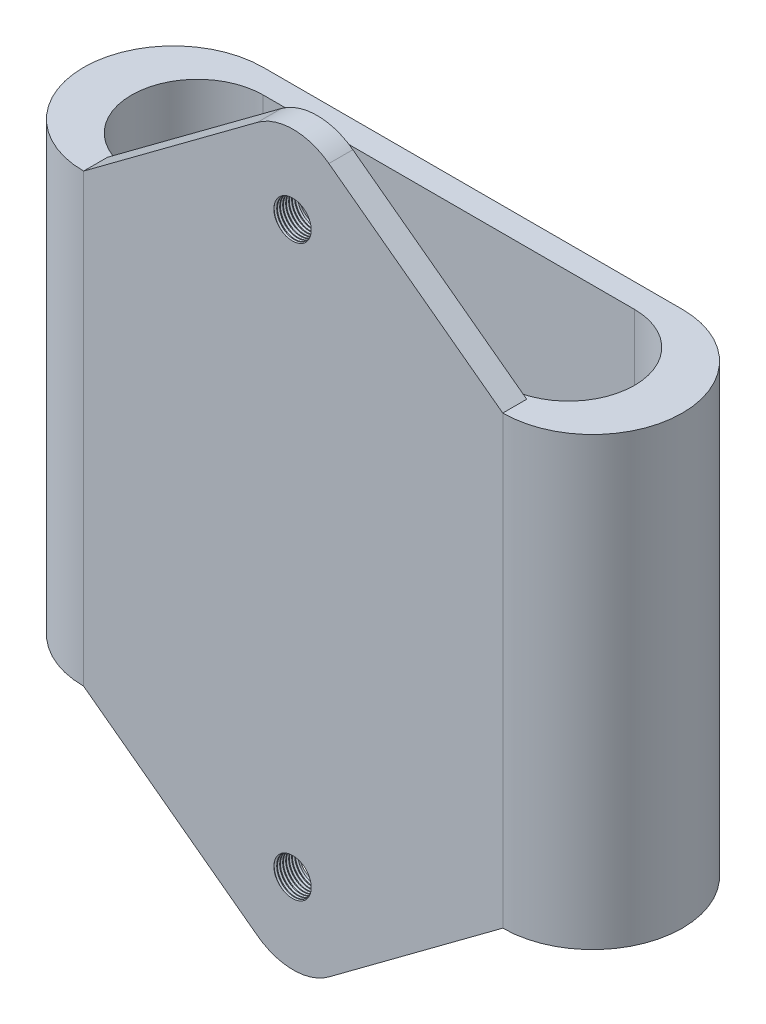
from build123d import *

# Parameters (mm, degrees)
BOSS_EXTRUDE2_DEPTH = 37.25
BOSS_EXTRUDE3_DEPTH = 2
SKETCH5_R           = 1.5
CUT_EXTRUDE1_DEPTH  = 2
THREAD1_PITCH       = 0.25
THREAD2_PITCH       = 0.25


with BuildPart() as part:
    # Sketch2 → Boss-Extrude2 (new body)
    with BuildSketch(Plane(origin=(0, 0, 0), x_dir=(1, 0, 0), z_dir=(0, 1, 0))):
        with BuildLine():
            Line((-17.5, 7.5), (17.5, 7.5))
            ThreePointArc((17.5, 7.5), (25, 0), (17.5, -7.5))
            Line((17.5, -7.5), (-17.5, -7.5))
            ThreePointArc((-17.5, -7.5), (-25, 0), (-17.5, 7.5))
        make_face()
        with BuildLine():
            Line((15.5, -5.5), (-15.5, -5.5))
            ThreePointArc((-15.5, -5.5), (-21, 0), (-15.5, 5.5))
            Line((-15.5, 5.5), (15.5, 5.5))
            ThreePointArc((15.5, 5.5), (21, 0), (15.5, -5.5))
        make_face(mode=Mode.SUBTRACT)
    extrude(amount=BOSS_EXTRUDE2_DEPTH)

    # Sketch3 → Boss-Extrude3 (add)
    with BuildSketch(Plane.XY.offset(7.5)):
        with BuildLine():
            Line((-17.5, 37.25), (-2.981620007, 48.035082281))
            ThreePointArc((-2.981620007, 48.035082281), (0, 49.021363041), (2.981620007, 48.035082281))
            Line((2.981620007, 48.035082281), (17.5, 37.25))
            Line((17.5, 37.25), (-17.5, 37.25))
        make_face()
        with BuildLine():
            Line((17.5, 0), (2.981620007, -10.785082281))
            ThreePointArc((2.981620007, -10.785082281), (0, -11.771363041), (-2.981620007, -10.785082281))
            Line((-2.981620007, -10.785082281), (-17.5, 0))
            Line((-17.5, 0), (17.5, 0))
        make_face()
    extrude(amount=-BOSS_EXTRUDE3_DEPTH)

    # Sketch5 → Cut-Extrude1 (cut)
    with BuildSketch(Plane(origin=(0, 0, 5.5), x_dir=(-1, 0, 0), z_dir=(0, 0, -1))):
        with Locations((0, 42.521363041)):
            Circle(SKETCH5_R)
        with Locations((0, -5.021363041)):
            Circle(SKETCH5_R)
    extrude(amount=-CUT_EXTRUDE1_DEPTH, mode=Mode.SUBTRACT)

    # Thread1: the profile of Thread Profile1 profile screwed along a right-hand helix of 8 turns, 6 arcs to a turn; built about Z, then put on its axis
    thread1_z = Axis((0, 0, 0), (0, 0, 1))
    thread1_corners = [(1.4997, 0, -0.000173205), (1.635316469, 0, 0.078125), (1.635316469, 0, 0.109375), (1.4997, 0, 0.187673204)]
    with BuildLine(mode=Mode.PRIVATE) as thread1_profile:
        Line(thread1_corners[0], thread1_corners[1])
        Line(thread1_corners[1], thread1_corners[2])
        Line(thread1_corners[2], thread1_corners[3])
        Line(thread1_corners[3], thread1_corners[0])
    thread1_cap = Face(thread1_profile.wire())
    thread1_turn_angles = [0, 30, 60, 90, 120, 150, 180, 210, 240, 270, 300, 330, 360]
    thread1_turn_weights = [1, 0.8660254037844387, 1, 0.8660254037844387, 1, 0.8660254037844387, 1, 0.8660254037844387, 1, 0.8660254037844387, 1, 0.8660254037844387, 1]
    thread1_turn_rails = [Edge.make_bspline([Vector(p[0], p[1], 0).rotate(thread1_z, thread1_turn_angles[k]) / thread1_turn_weights[k] + Vector(0, 0, p[2] + THREAD1_PITCH * thread1_turn_angles[k] / 360) for k in range(13)], [0, 0, 0, 1, 1, 2, 2, 3, 3, 4, 4, 5, 5, 6, 6, 6], 2, thread1_turn_weights) for p in thread1_corners]
    thread1_turn_sides = [Face.make_surface_from_curves(thread1_turn_rails[p[0]], thread1_turn_rails[p[1]]) for p in [(0, 1), (1, 2), (2, 3), (3, 0)]]
    thread1 = Plane(origin=(0, 42.521363041, 5.5), x_dir=(1, 0, 0), z_dir=(0, 0, 1)) * Solid(Shell([*[p.moved(Location((0, 0, THREAD1_PITCH * i))) for i in range(8) for p in thread1_turn_sides], thread1_cap, thread1_cap.rotate(thread1_z, 2880).moved(Location((0, 0, THREAD1_PITCH * 2880 / 360)))]))
    add(thread1, mode=Mode.SUBTRACT)

    # Thread2: the profile of Thread Profile2 profile screwed along a right-hand helix of 8 turns, 6 arcs to a turn; built about Z, then put on its axis
    thread2_z = Axis((0, 0, 0), (0, 0, 1))
    thread2_corners = [(1.4997, 0, -0.000173205), (1.635316469, 0, 0.078125), (1.635316469, 0, 0.109375), (1.4997, 0, 0.187673204)]
    with BuildLine(mode=Mode.PRIVATE) as thread2_profile:
        Line(thread2_corners[0], thread2_corners[1])
        Line(thread2_corners[1], thread2_corners[2])
        Line(thread2_corners[2], thread2_corners[3])
        Line(thread2_corners[3], thread2_corners[0])
    thread2_cap = Face(thread2_profile.wire())
    thread2_turn_angles = [0, 30, 60, 90, 120, 150, 180, 210, 240, 270, 300, 330, 360]
    thread2_turn_weights = [1, 0.8660254037844387, 1, 0.8660254037844387, 1, 0.8660254037844387, 1, 0.8660254037844387, 1, 0.8660254037844387, 1, 0.8660254037844387, 1]
    thread2_turn_rails = [Edge.make_bspline([Vector(p[0], p[1], 0).rotate(thread2_z, thread2_turn_angles[k]) / thread2_turn_weights[k] + Vector(0, 0, p[2] + THREAD2_PITCH * thread2_turn_angles[k] / 360) for k in range(13)], [0, 0, 0, 1, 1, 2, 2, 3, 3, 4, 4, 5, 5, 6, 6, 6], 2, thread2_turn_weights) for p in thread2_corners]
    thread2_turn_sides = [Face.make_surface_from_curves(thread2_turn_rails[p[0]], thread2_turn_rails[p[1]]) for p in [(0, 1), (1, 2), (2, 3), (3, 0)]]
    thread2 = Plane(origin=(0, -5.021363041, 5.5), x_dir=(1, 0, 0), z_dir=(0, 0, 1)) * Solid(Shell([*[p.moved(Location((0, 0, THREAD2_PITCH * i))) for i in range(8) for p in thread2_turn_sides], thread2_cap, thread2_cap.rotate(thread2_z, 2880).moved(Location((0, 0, THREAD2_PITCH * 2880 / 360)))]))
    add(thread2, mode=Mode.SUBTRACT)


solid = part.part
